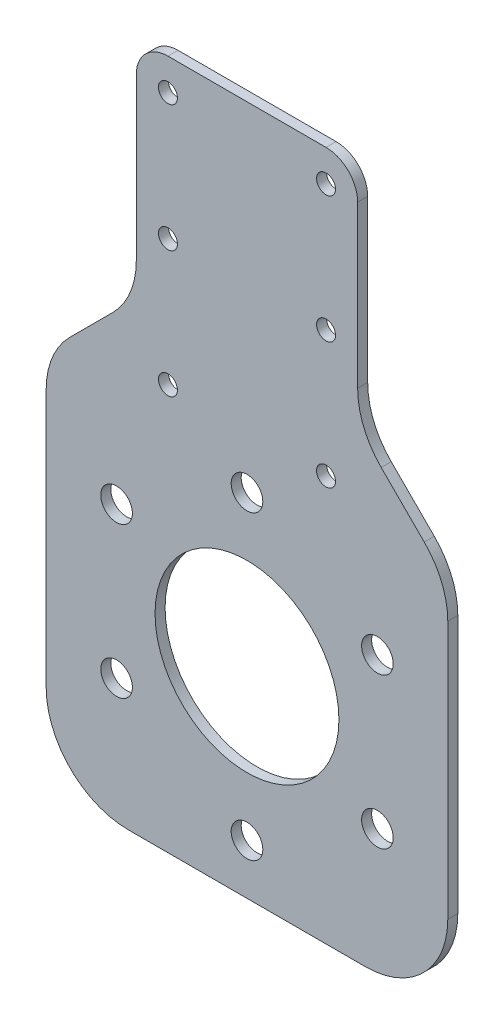
from build123d import *

# Parameters (mm, degrees)
SKETCH1_R           = 14.5375
SKETCH1_R_2         = 1.5
SKETCH1_R_3         = 2.5
BOSS_EXTRUDE1_DEPTH = 1.5875
FILLET1_R           = 5
FILLET2_R           = 13
CHAMFER1_SIZE       = 14.249999948
FILLET4_START       = -1
FILLET4_DEPTH       = 4
FILLET4_2_DEPTH     = 1.5875


with BuildPart() as part:
    # Sketch1 → Boss-Extrude1 (new body)
    with BuildSketch(Plane.XY):
        Polygon((14.25, 50), (49.25, 50), (49.25, 0), (63.5, 0), (63.5, -59.087), (0, -59.087), (0, 0), (14.25, 0), align=None)
        with Locations((31.75, -27.337)):
            Circle(SKETCH1_R, mode=Mode.SUBTRACT)
        with Locations((19.25, 45)):
            Circle(SKETCH1_R_2, mode=Mode.SUBTRACT)
        with Locations((19.25, 25)):
            Circle(SKETCH1_R_2, mode=Mode.SUBTRACT)
        with Locations((19.25, 5)):
            Circle(SKETCH1_R_2, mode=Mode.SUBTRACT)
        with Locations(Location((44.25, 5, 0), (0, 0, 180))):
            Circle(SKETCH1_R_2, mode=Mode.SUBTRACT)
        with Locations(Location((44.25, 25, 0), (0, 0, 180))):
            Circle(SKETCH1_R_2, mode=Mode.SUBTRACT)
        with Locations(Location((44.25, 45, 0), (0, 0, 180))):
            Circle(SKETCH1_R_2, mode=Mode.SUBTRACT)
        with Locations((31.75, -51.1495)):
            Circle(SKETCH1_R_3, mode=Mode.SUBTRACT)
        with Locations((11.127770072, -39.24325)):
            Circle(SKETCH1_R_3, mode=Mode.SUBTRACT)
        with Locations((11.127770072, -15.43075)):
            Circle(SKETCH1_R_3, mode=Mode.SUBTRACT)
        with Locations((31.75, -3.5245)):
            Circle(SKETCH1_R_3, mode=Mode.SUBTRACT)
        with Locations((52.372229928, -15.43075)):
            Circle(SKETCH1_R_3, mode=Mode.SUBTRACT)
        with Locations((52.372229928, -39.24325)):
            Circle(SKETCH1_R_3, mode=Mode.SUBTRACT)
    extrude(amount=BOSS_EXTRUDE1_DEPTH)

    # Fillet1
    fillet1_edges = [part.edges().sort_by_distance(p)[0] for p in [
        (14.25, 50, 0.79375),
        (49.25, 50, 0.79375),
    ]]
    fillet(fillet1_edges, radius=FILLET1_R)

    # Fillet2
    fillet2_edges = [part.edges().sort_by_distance(p)[0] for p in [
        (63.5, -59.087, 0.79375),
        (0, -59.087, 0.79375),
    ]]
    fillet(fillet2_edges, radius=FILLET2_R)

    # Chamfer1
    chamfer1_edges = [part.edges().sort_by_distance(p)[0] for p in [
        (49.25, 0, 0.79375),
        (14.25, 0, 0.79375),
    ]]
    chamfer(chamfer1_edges, length=CHAMFER1_SIZE)

    # Fillet4: read off the stored shape, not the designer's step
    # Fillet4 outline → Fillet4 (cut)
    with BuildSketch(Plane.XY.offset(FILLET4_START)):
        with BuildLine():
            ThreePointArc((0, -5.260512294), (0.966729937, -0.400432703), (3.719743879, 3.719743827))
            Line((3.719743879, 3.719743827), (2.6e-08, -2.6e-08))
            Line((2.6e-08, -2.6e-08), (0, -5.260512294))
        make_face()
        with BuildLine():
            Line((63.499999974, -2.6e-08), (59.780256121, 3.719743827))
            ThreePointArc((59.780256121, 3.719743827), (62.533270063, -0.400432703), (63.5, -5.260512294))
            Line((63.5, -5.260512294), (63.499999974, -2.6e-08))
        make_face()
    extrude(amount=FILLET4_DEPTH, mode=Mode.SUBTRACT)

    # Fillet4 2 outline → Fillet4 2 (add)
    with BuildSketch(Plane.XY):
        with BuildLine():
            ThreePointArc((14.25, 19.51051219), (13.283270063, 14.650432599), (10.530256121, 10.530256069))
            Line((10.530256121, 10.530256069), (14.25, 14.249999948))
            Line((14.25, 14.249999948), (14.25, 19.51051219))
        make_face()
        with BuildLine():
            Line((49.25, 14.249999948), (52.969743879, 10.530256069))
            ThreePointArc((52.969743879, 10.530256069), (50.216729937, 14.650432599), (49.25, 19.51051219))
            Line((49.25, 19.51051219), (49.25, 14.249999948))
        make_face()
    extrude(amount=FILLET4_2_DEPTH)


solid = part.part
